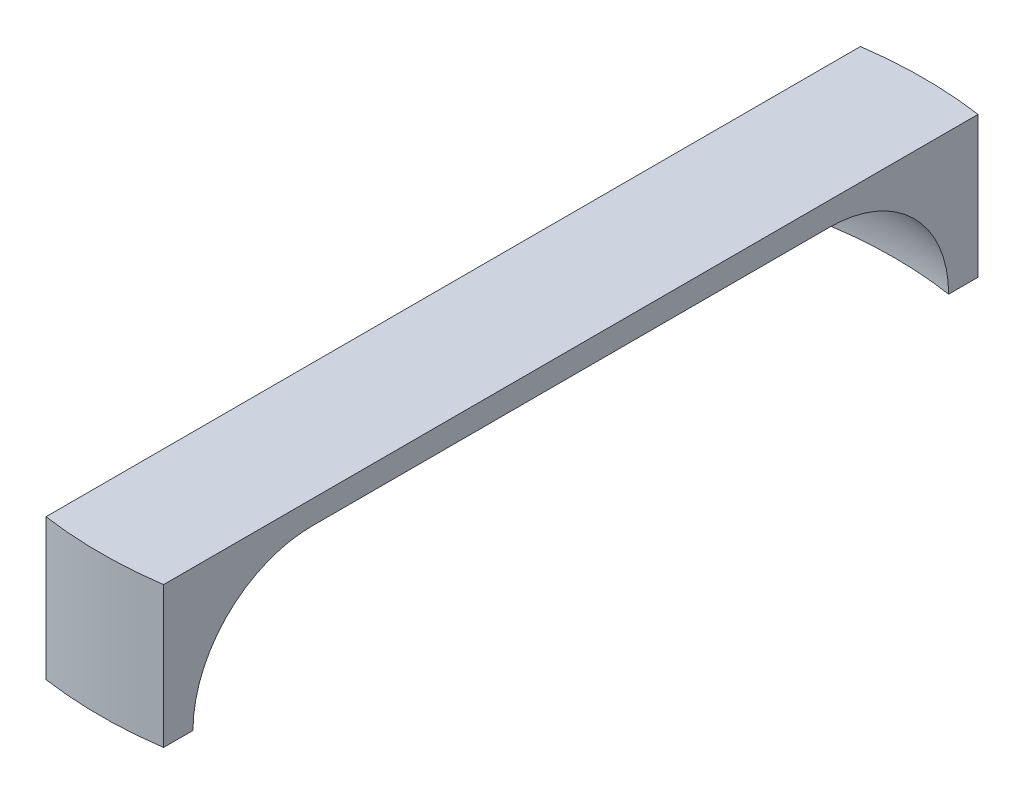
from build123d import *

# Parameters (mm, degrees)
AUFSATZ_LINEAR_AUSTRAGEN1_DEPTH = 4
AUFSATZ_LINEAR_START            = 20
AUFSATZ_LINEAR_AUSTRAGEN2_DEPTH = 20
VERRUNDUNG1_R                   = 20


with BuildPart() as part:
    # Skizze1 → Aufsatz-Linear austragen1 (new body)
    with BuildSketch(Plane(origin=(0, 0, 0), x_dir=(1, 0, 0), z_dir=(0, 1, 0))):
        with BuildLine():
            Line((-10, 69.282032303), (-10, -69.282032303))
            ThreePointArc((-10, -69.282032303), (0, -70), (10, -69.282032303))
            Line((10, -69.282032303), (10, 69.282032303))
            ThreePointArc((10, 69.282032303), (0, 70), (-10, 69.282032303))
        make_face()
    extrude(amount=AUFSATZ_LINEAR_AUSTRAGEN1_DEPTH)

    # Skizze2 → Aufsatz-Linear austragen2 (add)
    with BuildSketch(Plane.XZ.offset(AUFSATZ_LINEAR_START)):
        with BuildLine():
            Line((-10, 69.282032303), (-10, 64.282032303))
            ThreePointArc((-10, 64.282032303), (0, 65.055204842), (10, 64.282032303))
            Line((10, 64.282032303), (10, 69.282032303))
            ThreePointArc((10, 69.282032303), (0, 70), (-10, 69.282032303))
        make_face()
        with BuildLine():
            Line((-10, -64.282032303), (-10, -69.282032303))
            ThreePointArc((-10, -69.282032303), (0, -70), (10, -69.282032303))
            Line((10, -69.282032303), (10, -64.282032303))
            ThreePointArc((10, -64.282032303), (0, -65.055204842), (-10, -64.282032303))
        make_face()
    extrude(amount=-AUFSATZ_LINEAR_AUSTRAGEN2_DEPTH)

    # Verrundung1
    verrundung1_edges = [part.edges().sort_by_distance(p)[0] for p in [
        (0, 0, 65.055204842),
        (0, 0, -65.055204842),
    ]]
    fillet(verrundung1_edges, radius=VERRUNDUNG1_R - 0.0001)  # a hair under: the kernel refuses the full size


solid = part.part
